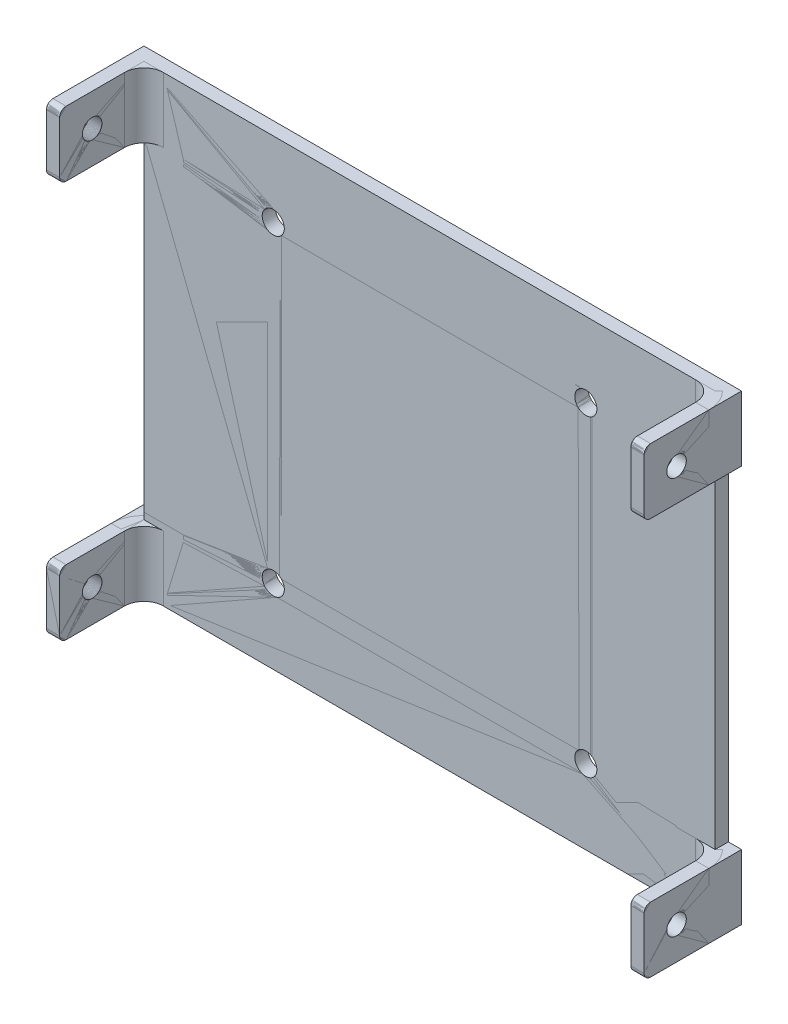
from build123d import *

# Parameters (mm, degrees)
SKETCH1_W                  = 87.8713
SKETCH1_H                  = 71.08326112
SKETCH1_R                  = 1.7
BOSS_EXTRUDE1_DEPTH        = 1.016
BOSS_EXTRUDE2_START        = 35.541631
SKETCH2_W                  = 2.032
SKETCH2_H                  = 15
BOSS_EXTRUDE2_DEPTH        = 10
BOSS_EXTRUDE3_START        = -35.541631
SKETCH2_2_W                = 2.032
SKETCH2_2_H                = 15
BOSS_EXTRUDE3_DEPTH        = 10
CUT_EXTRUDE1_DEPTH         = 60.764409448
CUT_EXTRUDE1_DEPTH_BACK    = 60.764409448
SKETCH3_R                  = 1.5
FILLET2_R                  = 1
CONVERT_SOLID3_START       = -43.93565
CONVERT_SOLID3_OUTLINE_W   = 10
CONVERT_SOLID3_OUTLINE_H   = 2.032
CONVERT_SOLID3_OUTLINE_W_2 = 49.05126112
CONVERT_SOLID3_DEPTH       = 87.8713
CONVERT_SOLID3_START_2     = -45.96765
CONVERT_SOLID3_2_OUTLINE_R = 1.5
CONVERT_SOLID3_2_DEPTH     = 5.032
CONVERT_SOLID3_START_3     = 40.93565
CONVERT_SOLID3_3_OUTLINE_R = 1.5
CONVERT_SOLID3_3_DEPTH     = 5.032
CONVERT_SOLID3_START_4     = -37.88765
CONVERT_SOLID3_4_OUTLINE_W = 1.016
CONVERT_SOLID3_4_OUTLINE_H = 2.032
CONVERT_SOLID3_4_DEPTH     = 75.7753
CONVERT_SOLID3_START_5     = -2
CONVERT_SOLID3_5_OUTLINE_R = 1.7
CONVERT_SOLID3_5_DEPTH     = 4
CONVERT_SOLID3_START_6     = -35.54163056
CONVERT_SOLID3_6_DEPTH     = 71.08326112
CONVERT_SOLID3_7_DEPTH     = 10
CONVERT_SOLID3_START_7     = 25.54163056
CONVERT_SOLID3_8_DEPTH     = 10


with BuildPart() as part:
    # Sketch1 → Boss-Extrude1 (new, symmetric)
    # profile 1 of 2: a face of its own
    with BuildSketch(Plane.XY):
        Rectangle(SKETCH1_W, SKETCH1_H)
        with BuildLine():
            ThreePointArc((18.424323487, 27.37780678), (0, 33), (-18.424323487, 27.37780678))
            ThreePointArc((-18.424323487, 27.37780678), (-20.638820721, 26.559371584), (-22.981976969, 26.848253846))
            ThreePointArc((-22.981976969, 26.848253846), (-26.162950904, 26.162950904), (-26.848253846, 22.981976969))
            ThreePointArc((-26.848253846, 22.981976969), (-26.559371584, 20.638820721), (-27.37780678, 18.424323487))
            ThreePointArc((-27.37780678, 18.424323487), (-33, 0), (-27.37780678, -18.424323487))
            ThreePointArc((-27.37780678, -18.424323487), (-26.559371584, -20.638820721), (-26.848253846, -22.981976969))
            ThreePointArc((-26.848253846, -22.981976969), (-26.162950904, -26.162950904), (-22.981976969, -26.848253846))
            ThreePointArc((-22.981976969, -26.848253846), (-20.638820721, -26.559371584), (-18.424323487, -27.37780678))
            ThreePointArc((-18.424323487, -27.37780678), (0, -33), (18.424323487, -27.37780678))
            ThreePointArc((18.424323487, -27.37780678), (20.638820721, -26.559371584), (22.981976969, -26.848253846))
            ThreePointArc((22.981976969, -26.848253846), (26.162950904, -26.162950904), (26.848253846, -22.981976969))
            ThreePointArc((26.848253846, -22.981976969), (26.559371584, -20.638820721), (27.37780678, -18.424323487))
            ThreePointArc((27.37780678, -18.424323487), (33, 0), (27.37780678, 18.424323487))
            ThreePointArc((27.37780678, 18.424323487), (26.559371584, 20.638820721), (26.848253846, 22.981976969))
            ThreePointArc((26.848253846, 22.981976969), (26.162950904, 26.162950904), (22.981976969, 26.848253846))
            ThreePointArc((22.981976969, 26.848253846), (20.638820721, 26.559371584), (18.424323487, 27.37780678))
        make_face(mode=Mode.SUBTRACT)
    # profile 2 of 2: a face of its own
    with BuildSketch(Plane.XY):
        with BuildLine():
            ThreePointArc((18.424323487, 27.37780678), (20.638820721, 26.559371584), (22.981976969, 26.848253846))
            ThreePointArc((22.981976969, 26.848253846), (26.162950904, 26.162950904), (26.848253846, 22.981976969))
            ThreePointArc((26.848253846, 22.981976969), (26.559371584, 20.638820721), (27.37780678, 18.424323487))
            ThreePointArc((27.37780678, 18.424323487), (33, 0), (27.37780678, -18.424323487))
            ThreePointArc((27.37780678, -18.424323487), (26.559371584, -20.638820721), (26.848253846, -22.981976969))
            ThreePointArc((26.848253846, -22.981976969), (26.162950904, -26.162950904), (22.981976969, -26.848253846))
            ThreePointArc((22.981976969, -26.848253846), (20.638820721, -26.559371584), (18.424323487, -27.37780678))
            ThreePointArc((18.424323487, -27.37780678), (0, -33), (-18.424323487, -27.37780678))
            ThreePointArc((-18.424323487, -27.37780678), (-20.638820721, -26.559371584), (-22.981976969, -26.848253846))
            ThreePointArc((-22.981976969, -26.848253846), (-26.162950904, -26.162950904), (-26.848253846, -22.981976969))
            ThreePointArc((-26.848253846, -22.981976969), (-26.559371584, -20.638820721), (-27.37780678, -18.424323487))
            ThreePointArc((-27.37780678, -18.424323487), (-33, 0), (-27.37780678, 18.424323487))
            ThreePointArc((-27.37780678, 18.424323487), (-26.559371584, 20.638820721), (-26.848253846, 22.981976969))
            ThreePointArc((-26.848253846, 22.981976969), (-26.162950904, 26.162950904), (-22.981976969, 26.848253846))
            ThreePointArc((-22.981976969, 26.848253846), (-20.638820721, 26.559371584), (-18.424323487, 27.37780678))
            ThreePointArc((-18.424323487, 27.37780678), (0, 33), (18.424323487, 27.37780678))
        make_face()
        with Locations((-24.04163056, -24.04163056)):
            Circle(SKETCH1_R, mode=Mode.SUBTRACT)
        with Locations((24.04163056, -24.04163056)):
            Circle(SKETCH1_R, mode=Mode.SUBTRACT)
        with Locations((24.04163056, 24.04163056)):
            Circle(SKETCH1_R, mode=Mode.SUBTRACT)
        with Locations((-24.04163056, 24.04163056)):
            Circle(SKETCH1_R, mode=Mode.SUBTRACT)
    extrude(amount=BOSS_EXTRUDE1_DEPTH, both=True)

    # Sketch2 → Boss-Extrude2 (add)
    with BuildSketch(Plane(origin=(0, 0, 0), x_dir=(1, 0, 0), z_dir=(0, 1, 0)).offset(BOSS_EXTRUDE2_START)):
        with Locations((-44.95165, -6.484)):
            Rectangle(SKETCH2_W, SKETCH2_H)
        with Locations((44.95165, -6.484)):
            Rectangle(SKETCH2_W, SKETCH2_H)
    extrude(amount=-BOSS_EXTRUDE2_DEPTH)

    # Sketch2<2> → Boss-Extrude3 (add)
    with BuildSketch(Plane(origin=(0, 0, 0), x_dir=(1, 0, 0), z_dir=(0, 1, 0)).offset(BOSS_EXTRUDE3_START)):
        with Locations((-44.95165, -6.484)):
            Rectangle(SKETCH2_2_W, SKETCH2_2_H)
        with Locations((44.95165, -6.484)):
            Rectangle(SKETCH2_2_W, SKETCH2_2_H)
    extrude(amount=BOSS_EXTRUDE3_DEPTH)

    # Sketch3 → Cut-Extrude1 (cut, two sides: drawn at the far end of the back side and taken through both)
    with BuildSketch(Plane(origin=(0, 0, 0), x_dir=(0, 0, -1), z_dir=(1, 0, 0)).offset(-CUT_EXTRUDE1_DEPTH_BACK)):
        with Locations((-8.984, 30.54163056)):
            Circle(SKETCH3_R)
        with Locations((-8.984, -30.54163056)):
            Circle(SKETCH3_R)
    extrude(amount=CUT_EXTRUDE1_DEPTH + CUT_EXTRUDE1_DEPTH_BACK, mode=Mode.SUBTRACT)

    # Fillet2
    fillet2_edges = [part.edges().sort_by_distance(p)[0] for p in [
        (-44.95165, 35.541631, 13.984),
        (-44.95165, 25.541631, 13.984),
        (44.95165, 35.541631, 13.984),
        (44.95165, 25.541631, 13.984),
        (-44.95165, -35.541631, 13.984),
        (-44.95165, -25.541631, 13.984),
        (44.95165, -35.541631, 13.984),
        (44.95165, -25.541631, 13.984),
    ]]
    fillet(fillet2_edges, radius=FILLET2_R)


with BuildPart() as body_2:
    # Convert-Solid3: read off the stored shape, not the designer's step
    # Convert-Solid3 outline → Convert-Solid3 (new body)
    with BuildSketch(Plane.YZ.offset(CONVERT_SOLID3_START)):
        with Locations((-30.54163056, 0)):
            Rectangle(CONVERT_SOLID3_OUTLINE_W, CONVERT_SOLID3_OUTLINE_H)
        Rectangle(CONVERT_SOLID3_OUTLINE_W_2, CONVERT_SOLID3_OUTLINE_H)
        with Locations((30.54163056, 0)):
            Rectangle(CONVERT_SOLID3_OUTLINE_W, CONVERT_SOLID3_OUTLINE_H)
    extrude(amount=CONVERT_SOLID3_DEPTH)

    # Convert-Solid3 2 outline → Convert-Solid3 2 (add)
    # profile 1 of 2: a face of its own
    with BuildSketch(Plane.YZ.offset(CONVERT_SOLID3_START_2)):
        with BuildLine():
            Line((-35.54163056, -1.016), (-25.54163056, -1.016))
            Line((-25.54163056, -1.016), (-25.54163056, 12.984))
            ThreePointArc((-25.54163056, 12.984), (-25.834523779, 13.691106781), (-26.54163056, 13.984))
            Line((-26.54163056, 13.984), (-34.54163056, 13.984))
            ThreePointArc((-34.54163056, 13.984), (-35.248737342, 13.691106781), (-35.54163056, 12.984))
            Line((-35.54163056, 12.984), (-35.54163056, -1.016))
        make_face()
        with Locations((-30.54163056, 8.984)):
            Circle(CONVERT_SOLID3_2_OUTLINE_R, mode=Mode.SUBTRACT)
    # profile 2 of 2: a face of its own
    with BuildSketch(Plane.YZ.offset(CONVERT_SOLID3_START_2)):
        with BuildLine():
            Line((35.54163056, -1.016), (35.54163056, 12.984))
            ThreePointArc((35.54163056, 12.984), (35.248737342, 13.691106781), (34.54163056, 13.984))
            Line((34.54163056, 13.984), (26.54163056, 13.984))
            ThreePointArc((26.54163056, 13.984), (25.834523779, 13.691106781), (25.54163056, 12.984))
            Line((25.54163056, 12.984), (25.54163056, -1.016))
            Line((25.54163056, -1.016), (35.54163056, -1.016))
        make_face()
        with Locations((30.54163056, 8.984)):
            Circle(CONVERT_SOLID3_2_OUTLINE_R, mode=Mode.SUBTRACT)
    extrude(amount=CONVERT_SOLID3_2_DEPTH)

    # Convert-Solid3 3 outline → Convert-Solid3 3 (add)
    # profile 1 of 2: a face of its own
    with BuildSketch(Plane.YZ.offset(CONVERT_SOLID3_START_3)):
        with BuildLine():
            Line((-35.54163056, -1.016), (-25.54163056, -1.016))
            Line((-25.54163056, -1.016), (-25.54163056, 12.984))
            ThreePointArc((-25.54163056, 12.984), (-25.834523779, 13.691106781), (-26.54163056, 13.984))
            Line((-26.54163056, 13.984), (-34.54163056, 13.984))
            ThreePointArc((-34.54163056, 13.984), (-35.248737342, 13.691106781), (-35.54163056, 12.984))
            Line((-35.54163056, 12.984), (-35.54163056, -1.016))
        make_face()
        with Locations((-30.54163056, 8.984)):
            Circle(CONVERT_SOLID3_3_OUTLINE_R, mode=Mode.SUBTRACT)
    # profile 2 of 2: a face of its own
    with BuildSketch(Plane.YZ.offset(CONVERT_SOLID3_START_3)):
        with BuildLine():
            Line((35.54163056, -1.016), (35.54163056, 12.984))
            ThreePointArc((35.54163056, 12.984), (35.248737342, 13.691106781), (34.54163056, 13.984))
            Line((34.54163056, 13.984), (26.54163056, 13.984))
            ThreePointArc((26.54163056, 13.984), (25.834523779, 13.691106781), (25.54163056, 12.984))
            Line((25.54163056, 12.984), (25.54163056, -1.016))
            Line((25.54163056, -1.016), (35.54163056, -1.016))
        make_face()
        with Locations((30.54163056, 8.984)):
            Circle(CONVERT_SOLID3_3_OUTLINE_R, mode=Mode.SUBTRACT)
    extrude(amount=CONVERT_SOLID3_3_DEPTH)

    # Convert-Solid3 4 outline → Convert-Solid3 4 (add)
    with BuildSketch(Plane.YZ.offset(CONVERT_SOLID3_START_4)):
        with Locations((-25.03363056, 0)):
            Rectangle(CONVERT_SOLID3_4_OUTLINE_W, CONVERT_SOLID3_4_OUTLINE_H)
        with Locations((25.03363056, 0)):
            Rectangle(CONVERT_SOLID3_4_OUTLINE_W, CONVERT_SOLID3_4_OUTLINE_H)
    extrude(amount=CONVERT_SOLID3_4_DEPTH)

    # Convert-Solid3 5 outline → Convert-Solid3 5 (cut)
    with BuildSketch(Plane.XY.offset(CONVERT_SOLID3_START_5)):
        with Locations((-24.04163056, -24.04163056)):
            Circle(CONVERT_SOLID3_5_OUTLINE_R)
        with Locations((24.04163056, -24.04163056)):
            Circle(CONVERT_SOLID3_5_OUTLINE_R)
        with Locations((24.04163056, 24.04163056)):
            Circle(CONVERT_SOLID3_5_OUTLINE_R)
        with Locations((-24.04163056, 24.04163056)):
            Circle(CONVERT_SOLID3_5_OUTLINE_R)
    extrude(amount=CONVERT_SOLID3_5_DEPTH, mode=Mode.SUBTRACT)

    # Convert-Solid3 6 outline → Convert-Solid3 6 (cut)
    with BuildSketch(Plane(origin=(0, 0, 0), x_dir=(1, 0, 0), z_dir=(0, 1, 0)).offset(CONVERT_SOLID3_START_6)):
        with BuildLine():
            Line((40.93565, -13.984), (43.93565, -13.984))
            Line((43.93565, -13.984), (43.93565, -4.016))
            ThreePointArc((43.93565, -4.016), (43.056970344, -1.894679656), (40.93565, -1.016))
            Line((40.93565, -1.016), (40.93565, -13.984))
        make_face()
        with BuildLine():
            Line((-40.93565, -13.984), (-40.93565, -1.016))
            ThreePointArc((-40.93565, -1.016), (-43.056970344, -1.894679656), (-43.93565, -4.016))
            Line((-43.93565, -4.016), (-43.93565, -13.984))
            Line((-43.93565, -13.984), (-40.93565, -13.984))
        make_face()
    extrude(amount=CONVERT_SOLID3_6_DEPTH, mode=Mode.SUBTRACT)

    # Convert-Solid3 7 outline → Convert-Solid3 7 (cut)
    with BuildSketch(Plane(origin=(0, 0, 0), x_dir=(1, 0, 0), z_dir=(0, 1, 0)).offset(CONVERT_SOLID3_START_6)):
        with BuildLine():
            ThreePointArc((40.93565, 1.016), (44.493811323, -0.457838677), (45.96765, -4.016))
            Line((45.96765, -4.016), (45.96765, 1.016))
            Line((45.96765, 1.016), (40.93565, 1.016))
        make_face()
        with BuildLine():
            ThreePointArc((-45.96765, -4.016), (-44.493811323, -0.457838677), (-40.93565, 1.016))
            Line((-40.93565, 1.016), (-45.96765, 1.016))
            Line((-45.96765, 1.016), (-45.96765, -4.016))
        make_face()
    extrude(amount=CONVERT_SOLID3_7_DEPTH, mode=Mode.SUBTRACT)

    # Convert-Solid3 8 outline → Convert-Solid3 8 (cut)
    with BuildSketch(Plane(origin=(0, 0, 0), x_dir=(1, 0, 0), z_dir=(0, 1, 0)).offset(CONVERT_SOLID3_START_7)):
        with BuildLine():
            ThreePointArc((40.93565, 1.016), (44.493811323, -0.457838677), (45.96765, -4.016))
            Line((45.96765, -4.016), (45.96765, 1.016))
            Line((45.96765, 1.016), (40.93565, 1.016))
        make_face()
        with BuildLine():
            ThreePointArc((-45.96765, -4.016), (-44.493811323, -0.457838677), (-40.93565, 1.016))
            Line((-40.93565, 1.016), (-45.96765, 1.016))
            Line((-45.96765, 1.016), (-45.96765, -4.016))
        make_face()
    extrude(amount=CONVERT_SOLID3_8_DEPTH, mode=Mode.SUBTRACT)


solid = Compound([part.part, body_2.part])
